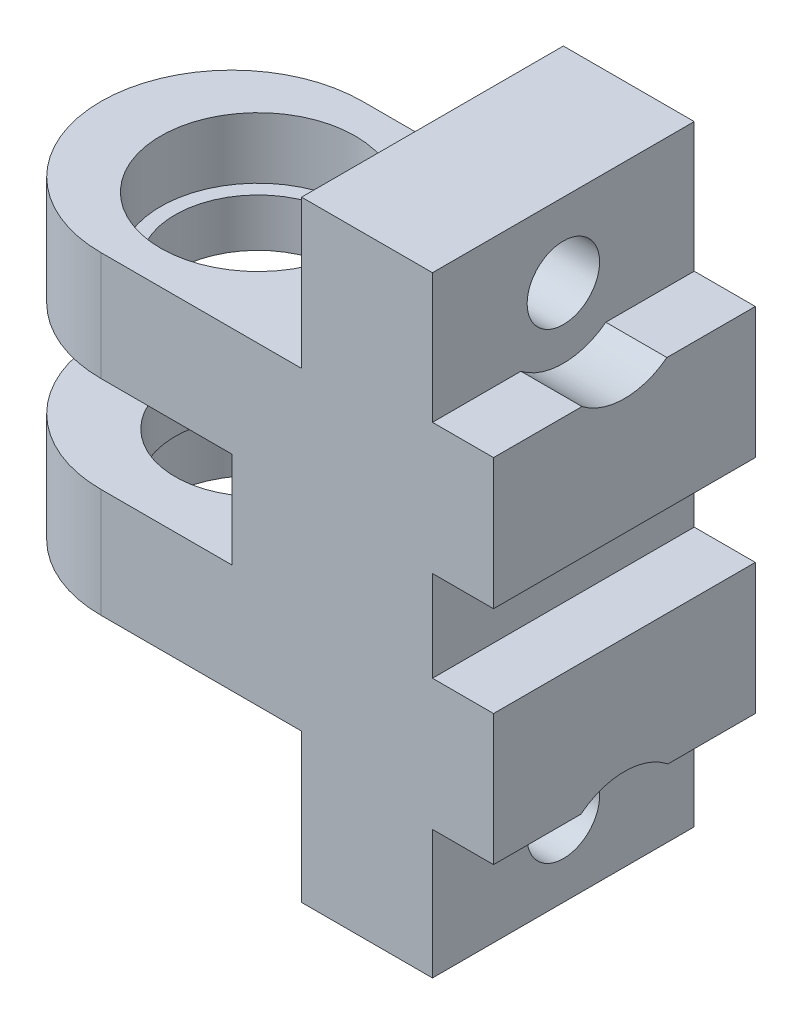
from build123d import *

# Parameters (mm, degrees)
SKETCH1_W           = 43
SKETCH1_H           = 30
BOSS_EXTRUDE1_DEPTH = 36
SKETCH2_W           = 30
SKETCH2_H           = 11
CUT_EXTRUDE1_DEPTH  = 30
SKETCH3_R           = 11.15
CUT_EXTRUDE2_DEPTH  = 7
CUT_EXTRUDE3_START  = -7
SKETCH4_R           = 11.15
CUT_EXTRUDE3_DEPTH  = 7
SKETCH5_R           = 9.5
CUT_EXTRUDE4_DEPTH  = 40.092838219
FILLET2_R           = 15
SKETCH6_W           = 30
SKETCH6_H           = 70
BOSS_EXTRUDE2_DEPTH = 10
SKETCH7_W           = 30
SKETCH7_H           = 15
BOSS_EXTRUDE3_DEPTH = 7
SKETCH8_R           = 4.15
CUT_EXTRUDE5_DEPTH  = 70.878465925
SKETCH9_R           = 8
CUT_EXTRUDE6_DEPTH  = 77.439518575
BOSS_EXTRUDE4_START = 5
SKETCH10_W          = 30
SKETCH10_H          = 17
SKETCH10_R          = 4.15
BOSS_EXTRUDE4_DEPTH = 5


with BuildPart() as part:
    # Sketch1 → Boss-Extrude1 (new body)
    with BuildSketch(Plane(origin=(0, 0, 0), x_dir=(1, 0, 0), z_dir=(0, 1, 0))):
        Rectangle(SKETCH1_W, SKETCH1_H)
    extrude(amount=BOSS_EXTRUDE1_DEPTH)

    # Sketch2 → Cut-Extrude1 (cut)
    with BuildSketch(Plane.ZY.offset(21.5)):
        with Locations((0, 18)):
            Rectangle(SKETCH2_W, SKETCH2_H)
    extrude(amount=-CUT_EXTRUDE1_DEPTH, mode=Mode.SUBTRACT)

    # Sketch3 → Cut-Extrude2 (cut)
    with BuildSketch(Plane(origin=(0, 36, 0), x_dir=(1, 0, 0), z_dir=(0, 1, 0))):
        with Locations(Location((-3.5, 0, 0), (0, 0, 270))):
            Circle(SKETCH3_R)
    extrude(amount=-CUT_EXTRUDE2_DEPTH, mode=Mode.SUBTRACT)

    # Sketch4 → Cut-Extrude3 (cut)
    with BuildSketch(Plane.XZ.offset(CUT_EXTRUDE3_START)):
        with Locations(Location((-3.5, 0, 0), (0, 0, 90))):
            Circle(SKETCH4_R)
    extrude(amount=CUT_EXTRUDE3_DEPTH, mode=Mode.SUBTRACT)

    # Sketch5 → Cut-Extrude4 (cut, through all)
    with BuildSketch(Plane(origin=(0, 29, 0), x_dir=(1, 0, 0), z_dir=(0, 1, 0))):
        with Locations(Location((-3.5, 0, 0), (0, 0, 90))):
            Circle(SKETCH5_R)
    extrude(amount=-CUT_EXTRUDE4_DEPTH, mode=Mode.SUBTRACT)

    # Fillet2
    fillet2_edges = [part.edges().sort_by_distance(p)[0] for p in [
        (-21.5, 6.25, -15),
        (-21.5, 6.25, 15),
        (-21.5, 29.75, 15),
        (-21.5, 29.75, -15),
    ]]
    fillet(fillet2_edges, radius=FILLET2_R - 0.0001)  # a hair under: the kernel refuses the full size

    # Sketch6 → Boss-Extrude2 (add)
    with BuildSketch(Plane(origin=(21.5, 0, 0), x_dir=(0, 0, -1), z_dir=(1, 0, 0))):
        with Locations((0, 18)):
            Rectangle(SKETCH6_W, SKETCH6_H)
    extrude(amount=BOSS_EXTRUDE2_DEPTH)

    # Sketch7 → Boss-Extrude3 (add)
    with BuildSketch(Plane(origin=(31.5, 0, 0), x_dir=(0, 0, -1), z_dir=(1, 0, 0))):
        with Locations((0, 30.65)):
            Rectangle(SKETCH7_W, SKETCH7_H)
        with Locations((0, 5.25)):
            Rectangle(SKETCH7_W, SKETCH7_H)
    extrude(amount=BOSS_EXTRUDE3_DEPTH)

    # Sketch8 → Cut-Extrude5 (cut, through all)
    with BuildSketch(Plane.ZY.offset(-21.5)):
        with Locations((0, -8.5)):
            Circle(SKETCH8_R)
        with Locations((0, 44.5)):
            Circle(SKETCH8_R)
    extrude(amount=-CUT_EXTRUDE5_DEPTH, mode=Mode.SUBTRACT)

    # Sketch9 → Cut-Extrude6 (cut, through all)
    with BuildSketch(Plane(origin=(31.5, 0, 0), x_dir=(0, 0, -1), z_dir=(1, 0, 0))):
        with Locations((0, -8.5)):
            Circle(SKETCH9_R)
        with Locations((0, 44.5)):
            Circle(SKETCH9_R)
    extrude(amount=CUT_EXTRUDE6_DEPTH, mode=Mode.SUBTRACT)

    # Sketch10 → Boss-Extrude4 (add)
    # profile 1 of 2: a face of its own
    with BuildSketch(Plane.ZY.offset(-21.5).offset(BOSS_EXTRUDE4_START)):
        with Locations((0, -8.5)):
            Rectangle(SKETCH10_W, SKETCH10_H)
        with Locations((0, -8.5)):
            Circle(SKETCH10_R, mode=Mode.SUBTRACT)
    # profile 2 of 2: a face of its own
    with BuildSketch(Plane.ZY.offset(-21.5).offset(BOSS_EXTRUDE4_START)):
        with Locations((0, 44.5)):
            Rectangle(SKETCH10_W, SKETCH10_H)
        with Locations((0, 44.5)):
            Circle(SKETCH10_R, mode=Mode.SUBTRACT)
    extrude(amount=-BOSS_EXTRUDE4_DEPTH)


solid = part.part
